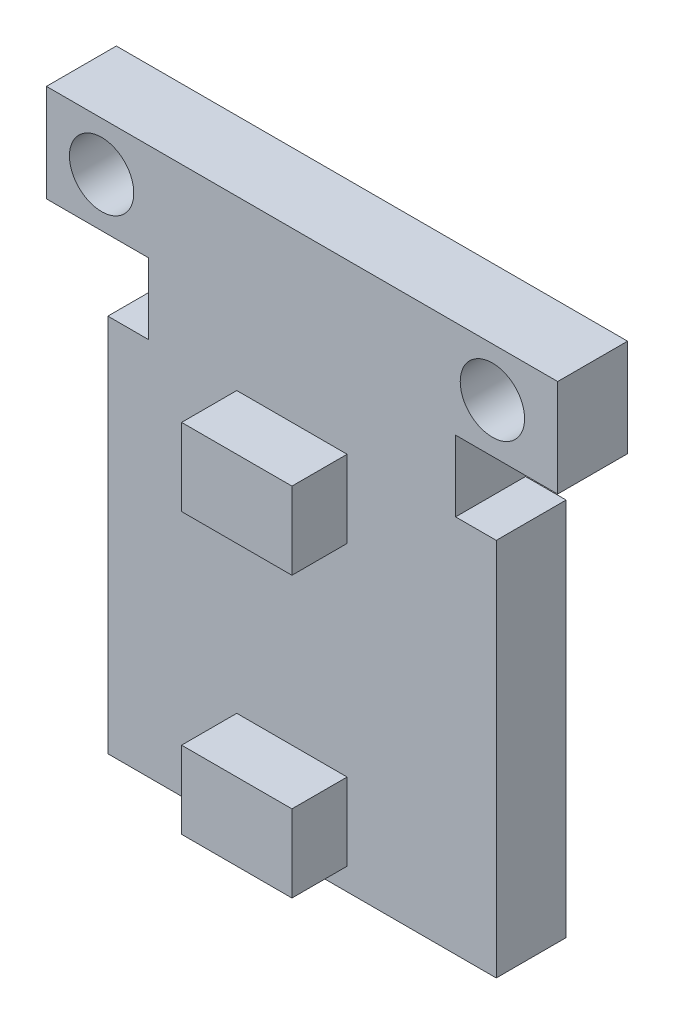
from build123d import *

# Parameters (mm, degrees)
SKETCH1_R           = 1.75
BOSS_EXTRUDE1_DEPTH = 3.8
SKETCH2_W           = 6
SKETCH2_H           = 4.2
BOSS_EXTRUDE2_DEPTH = 3
CUT_EXTRUDE1_DEPTH  = 1.2


with BuildPart() as part:
    # Sketch1 → Boss-Extrude1 (new body)
    with BuildSketch(Plane.XY):
        Polygon((-13.9, 0), (13.9, 0), (13.9, -5.3), (8.35, -5.3), (8.35, -9.15), (10.56, -9.15), (10.56, -29.76), (9.69, -29.76), (-10.56, -29.76), (-10.56, -9.15), (-8.35, -9.15), (-8.35, -5.3), (-13.9, -5.3), align=None)
        with Locations((-10.9, -2.65)):
            Circle(SKETCH1_R, mode=Mode.SUBTRACT)
        with Locations((10.35, -2.65)):
            Circle(SKETCH1_R, mode=Mode.SUBTRACT)
    extrude(amount=BOSS_EXTRUDE1_DEPTH)

    # Sketch2 → Boss-Extrude2 (add)
    with BuildSketch(Plane.XY.offset(3.8)):
        with Locations((-0.55, -11.25)):
            Rectangle(SKETCH2_W, SKETCH2_H)
        with Locations((-0.55, -26.45)):
            Rectangle(SKETCH2_W, SKETCH2_H)
    extrude(amount=BOSS_EXTRUDE2_DEPTH)

    # Sketch3 → Cut-Extrude1 (cut)
    # profile 1 of 10: a face of its own
    with BuildSketch(Plane(origin=(0, 0, 0), x_dir=(-1, 0, 0), z_dir=(0, 0, -1))):
        with BuildLine():
            add(Edge.make_bspline(
                [(-6.741761552, -15.054045758), (-6.676953446, -15.055687237), (-6.549664979, -15.058911238), (-6.362590081, -15.083590342), (-6.183994986, -15.126285732), (-6.012424847, -15.183148714), (-5.849931871, -15.259003099), (-5.695292978, -15.350688248), (-5.548876105, -15.459164707), (-5.412654723, -15.583593933), (-5.287997773, -15.718977387), (-5.178171886, -15.863455297), (-5.086129593, -16.0161541), (-5.010543806, -16.17661493), (-4.951245196, -16.344474898), (-4.910326152, -16.520628901), (-4.884188002, -16.703935591), (-4.881132225, -16.828962456), (-4.879582065, -16.892387104)],
                knots=[0, 0, 0, 0, 1.065120563, 2.091984664, 3.0946048, 4.079830382, 5.057816894, 6.036188127, 7.030412546, 8.04752943, 9.064399622, 10.05169764, 11.02544977, 11.989514704, 12.962713494, 13.945757189, 14.957906945, 16, 16, 16, 16], degree=3))
            add(Edge.make_bspline(
                [(-4.879582065, -16.892387104), (-4.881131997, -16.95534455), (-4.884187094, -17.079440971), (-4.910355872, -17.261584415), (-4.951396872, -17.436675111), (-5.009993138, -17.604420764), (-5.085218616, -17.764998328), (-5.177873787, -17.917985282), (-5.287014998, -18.06343178), (-5.411221849, -18.199744445), (-5.546622891, -18.324741916), (-5.691853158, -18.433660792), (-5.843646478, -18.527384916), (-6.003956186, -18.60216859), (-6.170656223, -18.661940511), (-6.345238546, -18.702693141), (-6.5268851, -18.728980184), (-6.650756104, -18.7319987), (-6.71371668, -18.733532937)],
                knots=[0, 0, 0, 0, 1.043624062, 2.057103931, 3.04512605, 4.022047818, 4.998200453, 5.980619268, 6.982898556, 8.009068085, 9.034988726, 10.034168286, 11.015286542, 11.987931943, 12.962482838, 13.94673481, 14.956375938, 16, 16, 16, 16], degree=3))
            add(Edge.make_bspline(
                [(-6.71371668, -18.733532937), (-6.777140999, -18.73198355), (-6.902167215, -18.728929296), (-7.085704251, -18.702747892), (-7.261981994, -18.661806588), (-7.430496346, -18.603297152), (-7.591341275, -18.527679921), (-7.744831358, -18.435475542), (-7.890350505, -18.326068401), (-8.026692252, -18.201901826), (-8.15144145, -18.066730274), (-8.260200826, -17.921896019), (-8.352425939, -17.770240562), (-8.427789271, -17.611343038), (-8.487453731, -17.445971596), (-8.528158549, -17.273023118), (-8.554494501, -17.093483612), (-8.557529347, -16.971240714), (-8.559069244, -16.909214027)],
                knots=[0, 0, 0, 0, 1.053102029, 2.075944431, 3.073151272, 4.055350789, 5.033113405, 6.020478099, 7.024410459, 8.052272461, 9.079885166, 10.07527673, 11.055994387, 12.023226415, 12.992069828, 13.970394897, 14.97016774, 16, 16, 16, 16], degree=3))
            add(Edge.make_bspline(
                [(-8.559069244, -16.909214027), (-8.558534609, -16.867581358), (-8.557472083, -16.784841234), (-8.54468039, -16.661974634), (-8.526118689, -16.541083976), (-8.499516776, -16.422513028), (-8.464725109, -16.306552044), (-8.423673082, -16.192401281), (-8.373533237, -16.081217557), (-8.316852589, -15.972474165), (-8.253590781, -15.86786626), (-8.183715031, -15.768986676), (-8.109679663, -15.67500568), (-8.028516269, -15.588358676), (-7.942899824, -15.506525019), (-7.851441446, -15.430762302), (-7.754699201, -15.360387351), (-7.652256822, -15.29696701), (-7.546638547, -15.239607876), (-7.437761769, -15.190386025), (-7.327105197, -15.148139963), (-7.214150549, -15.113899138), (-7.099197777, -15.086867102), (-6.981995993, -15.068459748), (-6.862638566, -15.055635431), (-6.782227248, -15.054577929), (-6.741761552, -15.054045758)],
                knots=[0, 0, 0, 0, 1.037015668, 2.060948919, 3.074880161, 4.083647147, 5.086022904, 6.090072063, 7.104153813, 8.122640571, 9.144368836, 10.147691507, 11.138137339, 12.123020368, 13.103399296, 14.087645067, 15.080126199, 16.082011238, 17.087798457, 18.072939717, 19.057185487, 20.037253025, 21.01195951, 21.997135196, 22.992090687, 24, 24, 24, 24], degree=3))
        make_face()
        with BuildLine():
            add(Edge.make_bspline(
                [(-6.726336873, -15.413020117), (-6.759551506, -15.413425007), (-6.825663239, -15.414230917), (-6.923947775, -15.424846632), (-7.020939709, -15.439976521), (-7.116659071, -15.461558042), (-7.210705361, -15.490962095), (-7.303955202, -15.524803003), (-7.395558256, -15.566024094), (-7.485212114, -15.612596798), (-7.572127189, -15.664145719), (-7.65413989, -15.721117486), (-7.731462534, -15.78217604), (-7.803905801, -15.847463877), (-7.871256973, -15.917313479), (-7.934841674, -15.990665915), (-7.992111256, -16.069617806), (-8.044596833, -16.152028213), (-8.091564673, -16.237789794), (-8.133330028, -16.325999657), (-8.167494037, -16.417377343), (-8.195356413, -16.510931501), (-8.218456224, -16.606513961), (-8.233090148, -16.70484981), (-8.243822507, -16.805444922), (-8.244582353, -16.873426776), (-8.24496668, -16.907811783)],
                knots=[0, 0, 0, 0, 1.008559885, 2.007477868, 2.99961109, 3.989939068, 4.984837346, 5.991145699, 7.001802488, 8.033829008, 9.059044045, 10.069351652, 11.065060232, 12.050310815, 13.029377138, 14.011219647, 14.996725999, 15.989392538, 16.977580475, 17.965360261, 18.951710183, 19.937753436, 20.929683414, 21.935841486, 22.955955122, 24, 24, 24, 24], degree=3))
            add(Edge.make_bspline(
                [(-8.24496668, -16.907811783), (-8.243691818, -16.958374004), (-8.24118377, -17.057845534), (-8.2192262, -17.203613678), (-8.185404226, -17.343701965), (-8.135546859, -17.477343874), (-8.073196245, -17.605688157), (-7.996169355, -17.727596262), (-7.904910269, -17.843101136), (-7.801246742, -17.951396405), (-7.687924036, -18.050242209), (-7.567591306, -18.137005618), (-7.441537698, -18.210415868), (-7.309434496, -18.27022094), (-7.171986957, -18.317610678), (-7.028309406, -18.350089309), (-6.879358946, -18.371464764), (-6.777828291, -18.37351752), (-6.726336873, -18.374558578)],
                knots=[0, 0, 0, 0, 1.032063989, 2.030389145, 3.003944642, 3.970395727, 4.937377036, 5.913328081, 6.909231446, 7.93887556, 8.970685674, 9.976071282, 10.964166581, 11.944589148, 12.933237628, 13.927779006, 14.949070134, 16, 16, 16, 16], degree=3))
            add(Edge.make_bspline(
                [(-6.726336873, -18.374558578), (-6.691727371, -18.374083074), (-6.623086335, -18.373140006), (-6.520990812, -18.363641329), (-6.420734601, -18.34840946), (-6.322458321, -18.326478804), (-6.226273509, -18.299031598), (-6.131778706, -18.26642387), (-6.039980416, -18.225742666), (-5.949720578, -18.180794714), (-5.863324336, -18.129554557), (-5.780848804, -18.074516407), (-5.704372824, -18.013547787), (-5.631983753, -17.949229974), (-5.564356064, -17.880266126), (-5.50194708, -17.806745904), (-5.444966947, -17.728205247), (-5.392501301, -17.645919841), (-5.345698038, -17.559923589), (-5.304918939, -17.471393911), (-5.270322823, -17.380548801), (-5.242394318, -17.28725723), (-5.220508857, -17.191696381), (-5.205428937, -17.093738303), (-5.194880498, -16.99357896), (-5.194085421, -16.925835104), (-5.193684629, -16.891685982)],
                knots=[0, 0, 0, 0, 1.047197238, 2.076906641, 3.100256066, 4.114471768, 5.12198147, 6.126382909, 7.136867548, 8.15857795, 9.17633901, 10.174870724, 11.156907918, 12.133735059, 13.104061851, 14.077631395, 15.04955518, 16.038496417, 17.029181396, 18.010275684, 18.986308667, 19.968651475, 20.955262928, 21.950658345, 22.966943676, 24, 24, 24, 24], degree=3))
            add(Edge.make_bspline(
                [(-5.193684629, -16.891685982), (-5.194085742, -16.857770478), (-5.194881423, -16.790492828), (-5.205423898, -16.691032009), (-5.220524788, -16.593778798), (-5.242287496, -16.499114995), (-5.27033765, -16.40701647), (-5.304924981, -16.317569722), (-5.34571028, -16.230441527), (-5.392518504, -16.14584723), (-5.445134328, -16.064672492), (-5.502628571, -15.987070079), (-5.565993919, -15.914497338), (-5.633419944, -15.845162644), (-5.70659083, -15.780544755), (-5.785175124, -15.720622234), (-5.868218801, -15.66394896), (-5.956146037, -15.612823398), (-6.046889991, -15.565609165), (-6.140003949, -15.525158162), (-6.234433048, -15.490786042), (-6.329937161, -15.461469077), (-6.427320139, -15.440061047), (-6.525923968, -15.424832997), (-6.625612226, -15.414234612), (-6.692655446, -15.413426233), (-6.726336873, -15.413020117)],
                knots=[0, 0, 0, 0, 1.02996197, 2.043119294, 3.035359645, 4.018872909, 4.991431989, 5.957985074, 6.929999688, 7.912076566, 8.892894881, 9.867085534, 10.843653904, 11.817741046, 12.803660682, 13.806313499, 14.818574707, 15.856120519, 16.894564902, 17.924820532, 18.937903209, 19.946497019, 20.957711757, 21.963978472, 22.977135795, 24, 24, 24, 24], degree=3))
        make_face(mode=Mode.SUBTRACT)
    # profile 2 of 10: a face of its own
    with BuildSketch(Plane(origin=(0, 0, 0), x_dir=(-1, 0, 0), z_dir=(0, 0, -1))):
        Polygon((-4.161633347, -15.143789348), (-3.847530783, -15.143789348), (-3.847530783, -18.284814989), (-2.501376937, -18.284814989), (-2.501376937, -18.643789348), (-4.161633347, -18.643789348), align=None)
    # profile 3 of 10: a face of its own
    with BuildSketch(Plane(origin=(0, 0, 0), x_dir=(-1, 0, 0), z_dir=(0, 0, -1))):
        Polygon((-1.918043603, -15.143789348), (0.056315371, -15.143789348), (0.056315371, -15.502763706), (-1.603941039, -15.502763706), (-1.603941039, -16.579686783), (0.056315371, -16.579686783), (0.056315371, -16.938661142), (-1.603941039, -16.938661142), (-1.603941039, -18.284814989), (0.056315371, -18.284814989), (0.056315371, -18.643789348), (-1.918043603, -18.643789348), align=None)
    # profile 4 of 10: a face of its own
    with BuildSketch(Plane(origin=(0, 0, 0), x_dir=(-1, 0, 0), z_dir=(0, 0, -1))):
        with BuildLine():
            Line((0.684520499, -18.643789348), (0.684520499, -15.143789348))
            Line((0.684520499, -15.143789348), (1.391251268, -15.143789348))
            add(Edge.make_bspline(
                [(1.391251268, -15.143789348), (1.452720257, -15.144231917), (1.571478022, -15.14508696), (1.743090469, -15.150508352), (1.901874232, -15.160098817), (2.047307091, -15.174068344), (2.179788303, -15.191221377), (2.298946911, -15.212721782), (2.405399054, -15.238109952), (2.470868495, -15.259755402), (2.501828192, -15.269991271)],
                knots=[0, 0, 0, 0, 1.314313732, 2.53924729, 3.670748893, 4.714932338, 5.66265055, 6.526160246, 7.303039223, 8, 8, 8, 8], degree=3))
            add(Edge.make_bspline(
                [(2.501828192, -15.269991271), (2.542322931, -15.285421976), (2.622394123, -15.31593347), (2.736401246, -15.373489772), (2.843726609, -15.438702873), (2.944945754, -15.511658736), (3.03774658, -15.594423085), (3.125754477, -15.68348017), (3.2053692, -15.78206851), (3.278277496, -15.888143498), (3.344013156, -16.000455551), (3.401152314, -16.118790659), (3.448606307, -16.242547867), (3.487999534, -16.371383015), (3.519045991, -16.505579393), (3.540227923, -16.645293259), (3.554198913, -16.789972449), (3.555602964, -16.888146912), (3.556315371, -16.937960021)],
                knots=[0, 0, 0, 0, 0.984719456, 1.947108742, 2.898477687, 3.838006223, 4.779231079, 5.722358779, 6.681677486, 7.655904652, 8.64651281, 9.637519902, 10.640069247, 11.656948941, 12.698408672, 13.768548281, 14.867775369, 16, 16, 16, 16], degree=3))
            add(Edge.make_bspline(
                [(3.556315371, -16.937960021), (3.555686404, -16.981221259), (3.554446957, -17.066472048), (3.543317642, -17.192112944), (3.527141321, -17.314026515), (3.502097124, -17.431632215), (3.47169461, -17.545960433), (3.432730459, -17.655792677), (3.388094963, -17.762136487), (3.336045084, -17.863553962), (3.278903699, -17.959637335), (3.217581956, -18.050212863), (3.152145261, -18.133988085), (3.081969628, -18.211216697), (3.007961911, -18.281782275), (2.929637581, -18.346274291), (2.84679453, -18.403430845), (2.759803807, -18.455497954), (2.666127678, -18.500918309), (2.563991812, -18.539348319), (2.452960634, -18.571194934), (2.333306677, -18.59776583), (2.204823199, -18.618843133), (2.067384233, -18.632969525), (1.921200944, -18.642522458), (1.820821678, -18.643358851), (1.769155916, -18.643789348)],
                knots=[0, 0, 0, 0, 1.105936401, 2.179363191, 3.223086493, 4.248585256, 5.251745608, 6.245858792, 7.225916811, 8.198733463, 9.158002045, 10.082870192, 10.993790845, 11.873723703, 12.748670949, 13.606408763, 14.465103618, 15.319838547, 16.196477973, 17.123216899, 18.106603292, 19.147568657, 20.255746949, 21.433717677, 22.679120308, 24, 24, 24, 24], degree=3))
            Line((1.769155916, -18.643789348), (0.684520499, -18.643789348))
        make_face()
        with BuildLine():
            Line((0.998623063, -18.284814989), (1.400365852, -18.284814989))
            add(Edge.make_bspline(
                [(1.400365852, -18.284814989), (1.458094223, -18.284566892), (1.569127021, -18.284089712), (1.728785018, -18.279902509), (1.874664415, -18.273060571), (2.006785924, -18.263485494), (2.125074948, -18.250816878), (2.229778698, -18.236691976), (2.320553957, -18.219094525), (2.375483394, -18.203143565), (2.400866653, -18.195772521)],
                knots=[0, 0, 0, 0, 1.375205317, 2.645023457, 3.804390687, 4.853969522, 5.800190428, 6.637939096, 7.370582563, 8, 8, 8, 8], degree=3))
            add(Edge.make_bspline(
                [(2.400866653, -18.195772521), (2.432815015, -18.184520962), (2.495948653, -18.162286589), (2.586829739, -18.121728928), (2.671586743, -18.073686858), (2.751696768, -18.020284584), (2.826023424, -17.959638582), (2.89544754, -17.893067593), (2.959829342, -17.820232818), (3.01850365, -17.741224657), (3.071011954, -17.656534861), (3.116483183, -17.566996027), (3.156334715, -17.473589217), (3.187613307, -17.374880059), (3.212128891, -17.271751), (3.229493579, -17.164194787), (3.240308304, -17.052231505), (3.241569752, -16.976079381), (3.242212807, -16.937258899)],
                knots=[0, 0, 0, 0, 0.998632004, 1.973411704, 2.929992603, 3.868527914, 4.809262121, 5.754881198, 6.702106254, 7.672490631, 8.653608572, 9.636854334, 10.631411391, 11.644891563, 12.686317036, 13.754757253, 14.855430412, 16, 16, 16, 16], degree=3))
            add(Edge.make_bspline(
                [(3.242212807, -16.937258899), (3.24169952, -16.896325418), (3.240691162, -16.815911234), (3.228016852, -16.697920539), (3.209495296, -16.584439888), (3.18271161, -16.475461693), (3.148580731, -16.370773341), (3.105986089, -16.270953831), (3.05731947, -16.174948962), (2.999416133, -16.084974596), (2.93600054, -15.999881487), (2.865622661, -15.921926571), (2.789400622, -15.850932271), (2.708165773, -15.785792958), (2.619628673, -15.729129282), (2.525874983, -15.678442601), (2.425529311, -15.63542671), (2.355716616, -15.612547847), (2.320237647, -15.600920758)],
                knots=[0, 0, 0, 0, 1.122418816, 2.205001699, 3.251619955, 4.274784885, 5.280384055, 6.268708349, 7.249350384, 8.229342522, 9.199999885, 10.157847722, 11.105861043, 12.055065948, 13.010012805, 13.98527497, 14.976112212, 16, 16, 16, 16], degree=3))
            add(Edge.make_bspline(
                [(2.320237647, -15.600920758), (2.2908865, -15.59280433), (2.22847791, -15.575546577), (2.126638446, -15.556721205), (2.012023297, -15.540116706), (1.884123595, -15.526058666), (1.743085136, -15.515971345), (1.588799448, -15.50840003), (1.421199844, -15.503293398), (1.30501731, -15.502944691), (1.244716813, -15.502763706)],
                knots=[0, 0, 0, 0, 0.674548936, 1.434276114, 2.292660221, 3.240891867, 4.284742987, 5.42552168, 6.663806718, 8, 8, 8, 8], degree=3))
            Line((1.244716813, -15.502763706), (0.998623063, -15.502763706))
            Line((0.998623063, -15.502763706), (0.998623063, -18.284814989))
        make_face(mode=Mode.SUBTRACT)
    # profile 5 of 10: a face of its own
    with BuildSketch(Plane(origin=(0, 0, 0), x_dir=(-1, 0, 0), z_dir=(0, 0, -1))):
        with BuildLine():
            Line((-8.738556424, -24.801942392), (-8.442683026, -24.624558578))
            add(Edge.make_bspline(
                [(-8.442683026, -24.624558578), (-8.415164789, -24.670622963), (-8.362440909, -24.758880547), (-8.274489549, -24.878138588), (-8.183356638, -24.979500744), (-8.088367305, -25.062377352), (-7.990101357, -25.127626239), (-7.887917303, -25.17382847), (-7.782159492, -25.202644446), (-7.710185671, -25.206144532), (-7.674253539, -25.207891912)],
                knots=[0, 0, 0, 0, 1.272034388, 2.437168799, 3.508375237, 4.49857839, 5.41946034, 6.295179144, 7.148887113, 8, 8, 8, 8], degree=3))
            add(Edge.make_bspline(
                [(-7.674253539, -25.207891912), (-7.643566679, -25.207037239), (-7.582729906, -25.205342849), (-7.493167663, -25.189062047), (-7.40618586, -25.164049918), (-7.323577223, -25.128228986), (-7.246481608, -25.084890501), (-7.178874913, -25.032544323), (-7.1204288, -24.973938117), (-7.072619685, -24.908555463), (-7.03593965, -24.838238314), (-7.007747581, -24.766062363), (-6.992102508, -24.690893795), (-6.989745754, -24.640283332), (-6.988556424, -24.614742873)],
                knots=[0, 0, 0, 0, 1.095163259, 2.171163733, 3.241058638, 4.321873601, 5.38011039, 6.391990106, 7.366004449, 8.327778327, 9.272591725, 10.192022065, 11.087607919, 12, 12, 12, 12], degree=3))
            add(Edge.make_bspline(
                [(-6.988556424, -24.614742873), (-6.990030735, -24.585602023), (-6.993027793, -24.526362934), (-7.018359273, -24.438963281), (-7.05820852, -24.352470711), (-7.094971163, -24.298969446), (-7.114057225, -24.271193194)],
                knots=[0, 0, 0, 0, 0.938893495, 1.908633276, 2.914225137, 4, 4, 4, 4], degree=3))
            add(Edge.make_bspline(
                [(-7.114057225, -24.271193194), (-7.129727839, -24.25114637), (-7.162626334, -24.209060571), (-7.219183846, -24.146415336), (-7.285549961, -24.081796917), (-7.359453515, -24.01273786), (-7.443586604, -23.942450063), (-7.535314119, -23.867581785), (-7.636977978, -23.790980208), (-7.708277474, -23.739607643), (-7.745066841, -23.713100245)],
                knots=[0, 0, 0, 0, 0.722233717, 1.516239348, 2.393582979, 3.351407094, 4.387010283, 5.505090956, 6.712668013, 8, 8, 8, 8], degree=3))
            add(Edge.make_bspline(
                [(-7.745066841, -23.713100245), (-7.781890837, -23.686871657), (-7.852295513, -23.636724595), (-7.950754096, -23.562300311), (-8.038798559, -23.494256442), (-8.116037575, -23.431952429), (-8.182437172, -23.375379825), (-8.238520583, -23.325081886), (-8.28285914, -23.279698325), (-8.307514721, -23.250256983), (-8.318584469, -23.237038546)],
                knots=[0, 0, 0, 0, 1.452282411, 2.77665338, 3.964542531, 5.026858415, 5.96415736, 6.766646006, 7.446254459, 8, 8, 8, 8], degree=3))
            add(Edge.make_bspline(
                [(-8.318584469, -23.237038546), (-8.334057014, -23.216437509), (-8.364485851, -23.175922806), (-8.404651856, -23.112597948), (-8.438791019, -23.047774682), (-8.465553351, -22.981278818), (-8.48808957, -22.914043889), (-8.503247501, -22.845192643), (-8.512738898, -22.775034025), (-8.513710884, -22.727820524), (-8.51419745, -22.704185982)],
                knots=[0, 0, 0, 0, 1.068054152, 2.10047183, 3.106115577, 4.101338837, 5.06977816, 6.043150881, 7.020423561, 8, 8, 8, 8], degree=3))
            add(Edge.make_bspline(
                [(-8.51419745, -22.704185982), (-8.512892241, -22.667156208), (-8.51030972, -22.593888144), (-8.488469203, -22.486857313), (-8.45399631, -22.384670896), (-8.405701422, -22.288340562), (-8.343444069, -22.200374582), (-8.271398094, -22.119761095), (-8.185586608, -22.051992512), (-8.091433985, -21.992780454), (-7.988377613, -21.946434529), (-7.880386709, -21.911473549), (-7.767289637, -21.891664291), (-7.690686503, -21.888821526), (-7.651817642, -21.887379091)],
                knots=[0, 0, 0, 0, 1.005424448, 1.989358655, 2.955360095, 3.929531133, 4.905563448, 5.876582895, 6.856512386, 7.866279853, 8.892233794, 9.918561126, 10.94386622, 12, 12, 12, 12], degree=3))
            add(Edge.make_bspline(
                [(-7.651817642, -21.887379091), (-7.610573542, -21.888801643), (-7.52855219, -21.891630644), (-7.407902974, -21.916228175), (-7.291742258, -21.956928847), (-7.198298993, -22.003117505), (-7.125166232, -22.049248921), (-7.069393499, -22.091268745), (-7.012876048, -22.139643853), (-6.955157993, -22.1945031), (-6.897217334, -22.256349851), (-6.838193882, -22.32476054), (-6.777949613, -22.399317095), (-6.739193753, -22.452541596), (-6.719325655, -22.479827008)],
                knots=[0, 0, 0, 0, 1.286793592, 2.559021753, 3.825965368, 5.121522368, 5.803751409, 6.523245864, 7.299691795, 8.125521123, 9.008227632, 9.944561021, 10.946284179, 12, 12, 12, 12], degree=3))
            Line((-6.719325655, -22.479827008), (-7.003279982, -22.695071399))
            add(Edge.make_bspline(
                [(-7.003279982, -22.695071399), (-7.020425914, -22.672982708), (-7.053444971, -22.630445055), (-7.103574458, -22.57087374), (-7.150823106, -22.51645726), (-7.197373506, -22.469192132), (-7.240767137, -22.426489999), (-7.282884179, -22.389930242), (-7.323118531, -22.359154646), (-7.373835441, -22.326311086), (-7.43755316, -22.293754583), (-7.517537696, -22.266205505), (-7.601123971, -22.249650443), (-7.658053602, -22.247461555), (-7.686873732, -22.24635345)],
                knots=[0, 0, 0, 0, 1.181633172, 2.275549214, 3.290209073, 4.226197932, 5.078386478, 5.862611352, 6.581680152, 7.217281963, 8.414376989, 9.595101626, 10.782541182, 12, 12, 12, 12], degree=3))
            add(Edge.make_bspline(
                [(-7.686873732, -22.24635345), (-7.723030254, -22.24756515), (-7.792754701, -22.249901799), (-7.891744937, -22.275421785), (-7.980838863, -22.315603645), (-8.057391428, -22.371918623), (-8.121128405, -22.438639616), (-8.167233863, -22.515418471), (-8.194984028, -22.600200873), (-8.198370308, -22.65934253), (-8.200094885, -22.689462424)],
                knots=[0, 0, 0, 0, 1.14458467, 2.207223713, 3.21896685, 4.227309161, 5.202851033, 6.127160689, 7.046193047, 8, 8, 8, 8], degree=3))
            add(Edge.make_bspline(
                [(-8.200094885, -22.689462424), (-8.199701759, -22.708213903), (-8.198914863, -22.745747522), (-8.187940065, -22.801198944), (-8.173840736, -22.856510284), (-8.151498104, -22.911432867), (-8.120652801, -22.966927226), (-8.080147625, -23.023948963), (-8.029134313, -23.083000672), (-7.9900573, -23.121408046), (-7.969425815, -23.141685982)],
                knots=[0, 0, 0, 0, 0.858281714, 1.717966888, 2.583508476, 3.4729293, 4.427298488, 5.488583878, 6.674047936, 8, 8, 8, 8], degree=3))
            add(Edge.make_bspline(
                [(-7.969425815, -23.141685982), (-7.961764442, -23.148523008), (-7.943562775, -23.164766216), (-7.91028685, -23.191358497), (-7.866344051, -23.224161269), (-7.81288185, -23.264748586), (-7.748914488, -23.311830048), (-7.674434932, -23.36480366), (-7.5902734, -23.425389119), (-7.530551484, -23.46774666), (-7.498973091, -23.490143514)],
                knots=[0, 0, 0, 0, 0.420754252, 0.999615792, 1.744751191, 2.668019286, 3.750313428, 4.999500688, 6.413464383, 8, 8, 8, 8], degree=3))
            add(Edge.make_bspline(
                [(-7.498973091, -23.490143514), (-7.460987177, -23.517784874), (-7.387432721, -23.571308535), (-7.282775141, -23.651724215), (-7.187881333, -23.730371984), (-7.102418129, -23.806749591), (-7.025541221, -23.880277684), (-6.9581035, -23.951840865), (-6.89941782, -24.020926437), (-6.836238601, -24.109499013), (-6.771680782, -24.218280097), (-6.716239274, -24.351558336), (-6.681280927, -24.485354656), (-6.676709412, -24.575281493), (-6.67445386, -24.619650726)],
                knots=[0, 0, 0, 0, 1.163667725, 2.253281268, 3.268753668, 4.215851969, 5.092017293, 5.902905408, 6.650798638, 7.335211899, 8.59617414, 9.77448103, 10.901945474, 12, 12, 12, 12], degree=3))
            add(Edge.make_bspline(
                [(-6.67445386, -24.619650726), (-6.675110998, -24.651029091), (-6.676412513, -24.713176474), (-6.691373427, -24.804431551), (-6.713293092, -24.893062421), (-6.746330326, -24.977973533), (-6.786653484, -25.060718296), (-6.837819732, -25.139126196), (-6.897127417, -25.214932595), (-6.965161182, -25.286116086), (-7.039607084, -25.351462282), (-7.118290779, -25.409591344), (-7.201341052, -25.458059667), (-7.288307368, -25.497610509), (-7.379209705, -25.528544027), (-7.474017489, -25.550956896), (-7.572887, -25.564712607), (-7.640087482, -25.566140368), (-7.674253539, -25.566866271)],
                knots=[0, 0, 0, 0, 0.983748083, 1.948392443, 2.894712957, 3.844097841, 4.80183111, 5.778335162, 6.776009319, 7.81870978, 8.863265674, 9.881300176, 10.883814829, 11.87499822, 12.874611388, 13.892143829, 14.928324115, 16, 16, 16, 16], degree=3))
            add(Edge.make_bspline(
                [(-7.674253539, -25.566866271), (-7.700688882, -25.566355089), (-7.753226642, -25.565339164), (-7.830936124, -25.556357883), (-7.907075713, -25.54365078), (-7.980689995, -25.52347671), (-8.052727407, -25.498999733), (-8.122874642, -25.4688614), (-8.191165695, -25.432744199), (-8.257983278, -25.391449174), (-8.323157453, -25.343391429), (-8.386076921, -25.287417933), (-8.448806106, -25.225072428), (-8.509493503, -25.154661865), (-8.569366647, -25.077323782), (-8.627245056, -24.992334598), (-8.684326774, -24.900157245), (-8.720142242, -24.835292159), (-8.738556424, -24.801942392)],
                knots=[0, 0, 0, 0, 0.915332311, 1.819136955, 2.706846663, 3.586547465, 4.459518054, 5.340707479, 6.227863349, 7.133153174, 8.059268498, 9.028702269, 10.047606654, 11.120612155, 12.245963614, 13.433783089, 14.680604001, 16, 16, 16, 16], degree=3))
        make_face()
    # profile 6 of 10: a face of its own
    with BuildSketch(Plane(origin=(0, 0, 0), x_dir=(-1, 0, 0), z_dir=(0, 0, -1))):
        with BuildLine():
            Line((-2.725735911, -22.619350245), (-3.000575655, -22.829686783))
            add(Edge.make_bspline(
                [(-3.000575655, -22.829686783), (-3.020181543, -22.806320814), (-3.05912899, -22.759903898), (-3.121788192, -22.694724353), (-3.187089835, -22.633659092), (-3.255008956, -22.576417212), (-3.326768076, -22.525000447), (-3.400628875, -22.476729344), (-3.47782692, -22.433461606), (-3.584578654, -22.38099862), (-3.724226503, -22.326252465), (-3.900021342, -22.280349233), (-4.08353244, -22.251128058), (-4.20873004, -22.247963216), (-4.272410591, -22.24635345)],
                knots=[0, 0, 0, 0, 0.757959112, 1.505699292, 2.245454638, 2.979532153, 3.711538275, 4.438200793, 5.171680507, 5.909471876, 7.393775596, 8.890124382, 10.418191784, 12, 12, 12, 12], degree=3))
            add(Edge.make_bspline(
                [(-4.272410591, -22.24635345), (-4.30749389, -22.246757413), (-4.377334882, -22.247561588), (-4.480983356, -22.258170714), (-4.582696407, -22.273081924), (-4.682407873, -22.295207247), (-4.779990832, -22.323179866), (-4.876083234, -22.35660528), (-4.969293834, -22.39796012), (-5.060912072, -22.44366838), (-5.148691283, -22.495295824), (-5.231746331, -22.551609176), (-5.309774299, -22.611978273), (-5.382836911, -22.676629379), (-5.451008859, -22.74527134), (-5.51379617, -22.818635681), (-5.57098158, -22.896487855), (-5.623698605, -22.977801262), (-5.670911339, -23.062339054), (-5.710441218, -23.150414124), (-5.74544634, -23.240518227), (-5.773145583, -23.333669388), (-5.7950701, -23.429212154), (-5.810197763, -23.527402942), (-5.820686234, -23.628036622), (-5.821486411, -23.696245934), (-5.821889757, -23.73062829)],
                knots=[0, 0, 0, 0, 1.054917814, 2.100044995, 3.131103042, 4.146048494, 5.169673617, 6.183595914, 7.203665975, 8.234915748, 9.262203917, 10.264457458, 11.251630812, 12.227803204, 13.197192746, 14.159520551, 15.12972552, 16.100847026, 17.073214652, 18.039054194, 19.002613845, 19.979014051, 20.95965708, 21.949030935, 22.966165397, 24, 24, 24, 24], degree=3))
            add(Edge.make_bspline(
                [(-5.821889757, -23.73062829), (-5.820627938, -23.78235961), (-5.818150524, -23.883927195), (-5.79610219, -24.032697805), (-5.762597099, -24.175218479), (-5.712381522, -24.310598321), (-5.650462471, -24.440506679), (-5.57222186, -24.562745533), (-5.481605322, -24.679162097), (-5.377330903, -24.787005045), (-5.262925087, -24.88551877), (-5.140177175, -24.972269352), (-5.009392887, -25.044584234), (-4.872016257, -25.104760181), (-4.726990143, -25.151016908), (-4.574575341, -25.183581032), (-4.415103346, -25.204823212), (-4.306133946, -25.2068569), (-4.250675815, -25.207891912)],
                knots=[0, 0, 0, 0, 1.029171465, 2.020641659, 2.987623507, 3.938342917, 4.889210282, 5.84687017, 6.821220943, 7.821438502, 8.827599549, 9.822697543, 10.807740252, 11.797342354, 12.80366471, 13.83203677, 14.896651826, 16, 16, 16, 16], degree=3))
            add(Edge.make_bspline(
                [(-4.250675815, -25.207891912), (-4.189573126, -25.206203132), (-4.069308417, -25.202879209), (-3.892940391, -25.17471996), (-3.724104625, -25.129062042), (-3.562792038, -25.06516412), (-3.409457392, -24.982098832), (-3.263860732, -24.881400955), (-3.125879161, -24.762112622), (-3.042907879, -24.671029494), (-3.000575655, -24.624558578)],
                knots=[0, 0, 0, 0, 1.028121516, 2.023589091, 2.998037872, 3.967518031, 4.937445131, 5.927275754, 6.942489185, 8, 8, 8, 8], degree=3))
            Line((-3.000575655, -24.624558578), (-2.725735911, -24.832791751))
            add(Edge.make_bspline(
                [(-2.725735911, -24.832791751), (-2.747854021, -24.861330203), (-2.791984296, -24.91827041), (-2.863442313, -24.998542119), (-2.938719611, -25.074046155), (-3.018375321, -25.144173776), (-3.101493112, -25.210328242), (-3.189565425, -25.270630073), (-3.281434457, -25.325920957), (-3.376788936, -25.376547882), (-3.475527549, -25.421465129), (-3.577531984, -25.459918896), (-3.682362559, -25.493043786), (-3.790024068, -25.520295723), (-3.900739824, -25.541566807), (-4.014110299, -25.555786481), (-4.130380174, -25.565528396), (-4.208821595, -25.566416312), (-4.24857245, -25.566866271)],
                knots=[0, 0, 0, 0, 0.986787822, 1.968848986, 2.935600012, 3.899624008, 4.868462664, 5.837806735, 6.815139263, 7.798259679, 8.787526145, 9.778297419, 10.776456485, 11.791383307, 12.812564526, 13.85620153, 14.913611965, 16, 16, 16, 16], degree=3))
            add(Edge.make_bspline(
                [(-4.24857245, -25.566866271), (-4.286216117, -25.566604278), (-4.360651807, -25.56608622), (-4.470550558, -25.557694053), (-4.577540139, -25.546244316), (-4.681314765, -25.529004185), (-4.78244074, -25.508659845), (-4.880001324, -25.481388588), (-4.974956535, -25.450839422), (-5.066924876, -25.414934435), (-5.155984575, -25.374418252), (-5.241848387, -25.328626693), (-5.324476819, -25.277944829), (-5.40468224, -25.223489818), (-5.481279824, -25.163512516), (-5.554933349, -25.098845882), (-5.626055825, -25.029707871), (-5.67005851, -24.979853018), (-5.692182225, -24.954786944)],
                knots=[0, 0, 0, 0, 1.114604814, 2.203992996, 3.262667896, 4.300477797, 5.318619304, 6.316056647, 7.298880507, 8.271930387, 9.238335007, 10.195173496, 11.151986948, 12.108099108, 13.064862484, 14.031167946, 15.010108607, 16, 16, 16, 16], degree=3))
            add(Edge.make_bspline(
                [(-5.692182225, -24.954786944), (-5.727617869, -24.911245755), (-5.798061345, -24.824689044), (-5.888187029, -24.684403063), (-5.965334584, -24.537934854), (-6.027710505, -24.384514925), (-6.076473238, -24.224487538), (-6.110254433, -24.057772024), (-6.132206038, -23.884524082), (-6.134716327, -23.766687293), (-6.135992321, -23.706790149)],
                knots=[0, 0, 0, 0, 0.994628077, 1.977248131, 2.950237994, 3.925870899, 4.908910175, 5.911660606, 6.938484602, 8, 8, 8, 8], degree=3))
            add(Edge.make_bspline(
                [(-6.135992321, -23.706790149), (-6.134437128, -23.643834695), (-6.131377382, -23.519973771), (-6.105381586, -23.338199817), (-6.06356279, -23.164048419), (-6.004165901, -22.997844674), (-5.92886055, -22.838714394), (-5.835833936, -22.687873189), (-5.726166794, -22.544356389), (-5.600719226, -22.410341638), (-5.463151891, -22.287802285), (-5.315833077, -22.179996082), (-5.15905113, -22.090278566), (-4.994533278, -22.015282403), (-4.821047597, -21.95763794), (-4.638964228, -21.917284753), (-4.448625313, -21.892167637), (-4.318762887, -21.888992429), (-4.25277918, -21.887379091)],
                knots=[0, 0, 0, 0, 1.032925535, 2.032216505, 3.007276963, 3.968222605, 4.92396291, 5.891752235, 6.871517503, 7.883894988, 8.900124299, 9.891468569, 10.874487609, 11.85992873, 12.854644235, 13.869047385, 14.917252991, 16, 16, 16, 16], degree=3))
            add(Edge.make_bspline(
                [(-4.25277918, -21.887379091), (-4.212564708, -21.887861229), (-4.132964211, -21.888815573), (-4.015211559, -21.898121715), (-3.900569232, -21.913635322), (-3.78895825, -21.934751391), (-3.679835633, -21.960958713), (-3.574035393, -21.995099011), (-3.470936706, -22.034135543), (-3.371189798, -22.079094008), (-3.275273247, -22.12956075), (-3.183216929, -22.184976373), (-3.09575207, -22.245272179), (-3.012263222, -22.309935354), (-2.934147011, -22.380333914), (-2.859185532, -22.45453151), (-2.789924454, -22.534665334), (-2.747171259, -22.591070268), (-2.725735911, -22.619350245)],
                knots=[0, 0, 0, 0, 1.096760587, 2.17092713, 3.219439832, 4.250915756, 5.268269357, 6.278326846, 7.281116186, 8.274029601, 9.260640565, 10.235837813, 11.203064059, 12.156899882, 13.114053108, 14.069676657, 15.032185724, 16, 16, 16, 16], degree=3))
        make_face()
    # profile 7 of 10: a face of its own
    with BuildSketch(Plane(origin=(0, 0, 0), x_dir=(-1, 0, 0), z_dir=(0, 0, -1))):
        with BuildLine():
            Line((-2.007787193, -21.977122681), (-1.30736652, -21.977122681))
            add(Edge.make_bspline(
                [(-1.30736652, -21.977122681), (-1.260625392, -21.977278267), (-1.170877247, -21.977577009), (-1.042303977, -21.979242772), (-0.92547688, -21.984017128), (-0.82045704, -21.988125711), (-0.727246385, -21.995617653), (-0.645559095, -22.0027783), (-0.575771397, -22.01215196), (-0.533525546, -22.020857383), (-0.51439777, -22.024798963)],
                knots=[0, 0, 0, 0, 1.410062039, 2.707475311, 3.878576406, 4.937260626, 5.877586885, 6.699081471, 7.410979367, 8, 8, 8, 8], degree=3))
            add(Edge.make_bspline(
                [(-0.51439777, -22.024798963), (-0.488791146, -22.031125728), (-0.438124156, -22.043644292), (-0.36517409, -22.070103893), (-0.295659766, -22.100723517), (-0.229869942, -22.136687238), (-0.168134151, -22.178262017), (-0.10981584, -22.22473014), (-0.054650377, -22.275837346), (-0.004868747, -22.332872187), (0.042070305, -22.392708697), (0.081658932, -22.457412454), (0.115785411, -22.525073981), (0.142955928, -22.596381399), (0.164833902, -22.670643171), (0.180260141, -22.748531967), (0.189511329, -22.829692943), (0.190453184, -22.885050851), (0.190930756, -22.913120277)],
                knots=[0, 0, 0, 0, 1.027469482, 2.033020251, 3.019912614, 3.986113645, 4.951240523, 5.91722682, 6.890402269, 7.87763091, 8.8651537, 9.85103654, 10.82876324, 11.815024772, 12.821070561, 13.842952187, 14.906261191, 16, 16, 16, 16], degree=3))
            add(Edge.make_bspline(
                [(0.190930756, -22.913120277), (0.189461758, -22.959755382), (0.186595362, -23.050752549), (0.159870258, -23.182813431), (0.116093738, -23.306002746), (0.055770449, -23.420165383), (-0.021049026, -23.523076029), (-0.113373818, -23.613466484), (-0.221255429, -23.689106397), (-0.321684745, -23.741559201), (-0.410398945, -23.77515211), (-0.483432257, -23.798788469), (-0.563099235, -23.817050434), (-0.64863657, -23.833410566), (-0.740400225, -23.84576226), (-0.838170264, -23.854808855), (-0.942016416, -23.860462904), (-1.013355485, -23.861304908), (-1.050054821, -23.861738065)],
                knots=[0, 0, 0, 0, 1.260483769, 2.459530307, 3.627416485, 4.787058657, 5.939039949, 7.08810263, 8.267026773, 9.491475466, 10.141966685, 10.831826277, 11.566392101, 12.351337768, 13.187381173, 14.07005841, 15.007169909, 16, 16, 16, 16], degree=3))
            Line((-1.050054821, -23.861738065), (0.23580255, -25.477122681))
            Line((0.23580255, -25.477122681), (-0.152618924, -25.477122681))
            Line((-0.152618924, -25.477122681), (-1.438476296, -23.861738065))
            Line((-1.438476296, -23.861738065), (-1.693684629, -23.861738065))
            Line((-1.693684629, -23.861738065), (-1.693684629, -25.477122681))
            Line((-1.693684629, -25.477122681), (-2.007787193, -25.477122681))
            Line((-2.007787193, -25.477122681), (-2.007787193, -21.977122681))
        make_face()
        with BuildLine():
            Line((-1.693684629, -22.33609704), (-1.693684629, -23.502763706))
            Line((-1.693684629, -23.502763706), (-1.052859308, -23.507671559))
            add(Edge.make_bspline(
                [(-1.052859308, -23.507671559), (-1.02293927, -23.507684796), (-0.964945712, -23.507710452), (-0.881045048, -23.503716676), (-0.802924936, -23.499173358), (-0.730884184, -23.492224012), (-0.664890608, -23.48326794), (-0.604977195, -23.472064956), (-0.551046143, -23.459012893), (-0.488147605, -23.438811268), (-0.417911074, -23.406805249), (-0.341579614, -23.360239751), (-0.276577276, -23.301670632), (-0.221659414, -23.234697175), (-0.177529982, -23.161060927), (-0.146417928, -23.081644557), (-0.126675486, -22.998452959), (-0.12434694, -22.941274852), (-0.123171808, -22.912419155)],
                knots=[0, 0, 0, 0, 1.146690395, 2.22261258, 3.21895312, 4.145990853, 4.996080663, 5.770904154, 6.481378293, 7.121626537, 8.300444488, 9.431385265, 10.535395872, 11.636531494, 12.74115979, 13.810798291, 14.895190096, 16, 16, 16, 16], degree=3))
            add(Edge.make_bspline(
                [(-0.123171808, -22.912419155), (-0.12437393, -22.884272581), (-0.126756095, -22.828496343), (-0.146204863, -22.746840432), (-0.179094245, -22.669773482), (-0.223416483, -22.597608997), (-0.277415638, -22.532103262), (-0.34073345, -22.476056108), (-0.411638646, -22.429806644), (-0.477909844, -22.400252263), (-0.537144056, -22.38213241), (-0.588573716, -22.369381246), (-0.646685194, -22.359136777), (-0.711760653, -22.350928716), (-0.783522284, -22.343873772), (-0.862332935, -22.339121994), (-0.947669715, -22.336308129), (-1.006816646, -22.336169041), (-1.037434629, -22.33609704)],
                knots=[0, 0, 0, 0, 1.101028733, 2.181837193, 3.264309656, 4.369019818, 5.486613113, 6.575447106, 7.666700264, 8.788928104, 9.402425223, 10.0903467, 10.862060571, 11.710948788, 12.657782767, 13.684531032, 14.801375019, 16, 16, 16, 16], degree=3))
            Line((-1.037434629, -22.33609704), (-1.693684629, -22.33609704))
        make_face(mode=Mode.SUBTRACT)
    # profile 8 of 10: a face of its own
    with BuildSketch(Plane(origin=(0, 0, 0), x_dir=(-1, 0, 0), z_dir=(0, 0, -1))):
        Polygon((0.953751268, -21.977122681), (2.928110243, -21.977122681), (2.928110243, -22.33609704), (1.267853833, -22.33609704), (1.267853833, -23.413020117), (2.928110243, -23.413020117), (2.928110243, -23.771994476), (1.267853833, -23.771994476), (1.267853833, -25.118148322), (2.928110243, -25.118148322), (2.928110243, -25.477122681), (0.953751268, -25.477122681), align=None)
    # profile 9 of 10: a face of its own
    with BuildSketch(Plane(origin=(0, 0, 0), x_dir=(-1, 0, 0), z_dir=(0, 0, -1))):
        Polygon((3.556315371, -21.977122681), (5.530674345, -21.977122681), (5.530674345, -22.33609704), (3.870417935, -22.33609704), (3.870417935, -23.413020117), (5.530674345, -23.413020117), (5.530674345, -23.771994476), (3.870417935, -23.771994476), (3.870417935, -25.118148322), (5.530674345, -25.118148322), (5.530674345, -25.477122681), (3.556315371, -25.477122681), align=None)
    # profile 10 of 10: a face of its own
    with BuildSketch(Plane(origin=(0, 0, 0), x_dir=(-1, 0, 0), z_dir=(0, 0, -1))):
        Polygon((6.158879474, -25.477122681), (6.158879474, -21.977122681), (6.224784922, -21.977122681), (8.537084602, -24.731830213), (8.537084602, -21.977122681), (8.851187166, -21.977122681), (8.851187166, -25.477122681), (8.779672743, -25.477122681), (6.472982038, -22.728725245), (6.472982038, -25.477122681), align=None)
    extrude(amount=-CUT_EXTRUDE1_DEPTH, mode=Mode.SUBTRACT)


solid = part.part
